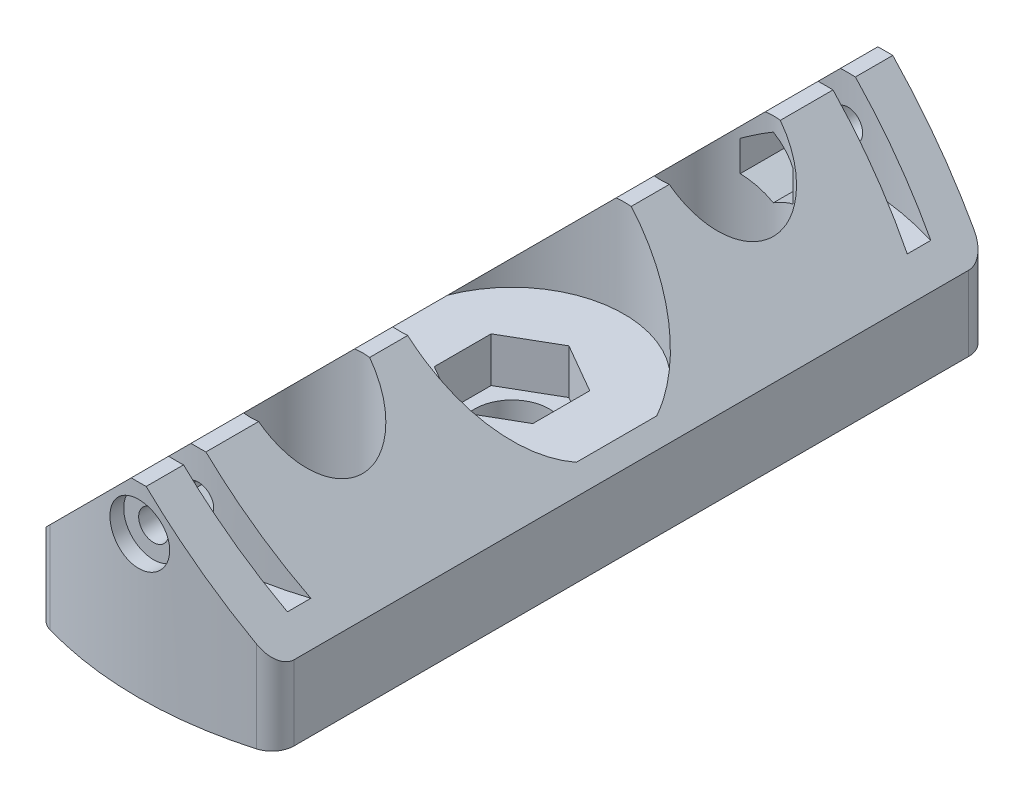
from build123d import *

# Parameters (mm, degrees)
SKETCH1_R               = 5
SKETCH1_R_2             = 6
BOSS_EXTRUDE1_DEPTH     = 25
SKETCH2_R               = 7.5
CUT_EXTRUDE1_DEPTH      = 24
SKETCH3_R               = 15
CUT_EXTRUDE2_DEPTH      = 13
CUT_EXTRUDE3_DEPTH      = 6
SKETCH5_R               = 45
SKETCH5_R_2             = 42
CUT_EXTRUDE_THIN1_DEPTH = 12
CHAMFER1_SIZE           = 15
SKETCH6_R               = 4
CUT_EXTRUDE4_DEPTH      = 2
SKETCH7_R               = 2
CUT_EXTRUDE5_DEPTH      = 20
CUT_EXTRUDE6_REACH      = 111.896
CUT_EXTRUDE6_END_RADIUS = 7.5
CUT_EXTRUDE6_START      = -7.5


with BuildPart() as part:
    # Sketch1 → Boss-Extrude1 (new body)
    with BuildSketch(Plane(origin=(0, 0, 0), x_dir=(1, 0, 0), z_dir=(0, 1, 0))):
        with BuildLine():
            Line((-16, 45.166359163), (-16, -45.166359163))
            ThreePointArc((-16, -45.166359163), (-15.396806386, -46.970609464), (-13.829787234, -48.049318258))
            ThreePointArc((-13.829787234, -48.049318258), (0, -50), (13.829787234, -48.049318258))
            ThreePointArc((13.829787234, -48.049318258), (15.396806386, -46.970609464), (16, -45.166359163))
            Line((16, -45.166359163), (16, 45.166359163))
            ThreePointArc((16, 45.166359163), (15.396806386, 46.970609464), (13.829787234, 48.049318258))
            ThreePointArc((13.829787234, 48.049318258), (0, 50), (-13.829787234, 48.049318258))
            ThreePointArc((-13.829787234, 48.049318258), (-15.396806386, 46.970609464), (-16, 45.166359163))
        make_face()
        with Locations(Location((0, 0, 0), (0, 0, 270))):
            Circle(SKETCH1_R, mode=Mode.SUBTRACT)
        with Locations(Location((0, -27.5, 0), (0, 0, 270))):
            Circle(SKETCH1_R_2, mode=Mode.SUBTRACT)
        with Locations(Location((0, 27.5, 0), (0, 0, 270))):
            Circle(SKETCH1_R_2, mode=Mode.SUBTRACT)
    extrude(amount=BOSS_EXTRUDE1_DEPTH)

    # Sketch2 → Cut-Extrude1 (cut)
    with BuildSketch(Plane(origin=(0, 25, 0), x_dir=(1, 0, 0), z_dir=(0, 1, 0))):
        with Locations(Location((0, 27.5, 0), (0, 0, 270))):
            Circle(SKETCH2_R)
        with Locations(Location((0, -27.5, 0), (0, 0, 270))):
            Circle(SKETCH2_R)
    extrude(amount=-CUT_EXTRUDE1_DEPTH, mode=Mode.SUBTRACT)

    # Sketch3 → Cut-Extrude2 (cut)
    with BuildSketch(Plane(origin=(0, 25, 0), x_dir=(1, 0, 0), z_dir=(0, 1, 0))):
        with Locations(Location((0, 0, 0), (0, 0, 270))):
            Circle(SKETCH3_R)
    extrude(amount=-CUT_EXTRUDE2_DEPTH, mode=Mode.SUBTRACT)

    # Sketch4 → Cut-Extrude3 (cut)
    with BuildSketch(Plane(origin=(0, 12, 0), x_dir=(1, 0, 0), z_dir=(0, 1, 0))):
        Polygon((0, 7.621023553), (-6.6, 3.810511777), (-6.6, -3.810511777), (0, -7.621023553), (6.6, -3.810511777), (6.6, 3.810511777), align=None)
    extrude(amount=-CUT_EXTRUDE3_DEPTH, mode=Mode.SUBTRACT)

    # Sketch5 → Cut-Extrude-Thin1 (cut)
    with BuildSketch(Plane(origin=(0, 25, 0), x_dir=(1, 0, 0), z_dir=(0, 1, 0))):
        Circle(SKETCH5_R)
        Circle(SKETCH5_R_2, mode=Mode.SUBTRACT)
    extrude(amount=-CUT_EXTRUDE_THIN1_DEPTH, mode=Mode.SUBTRACT)

    # Chamfer1
    # the kernel refuses this chamfer: 15 mm, written as the material it takes off along each edge
    with BuildSketch(Plane(origin=(-16, 25, -77.408220497), x_dir=(-0.02749587661058632, -0.9996219169112968, 0), z_dir=(0, 0, 1))) as chamfer1_piece_1:
        Polygon((CHAMFER1_SIZE * 0.999621916911, CHAMFER1_SIZE * 0.0274958766106), (-CHAMFER1_SIZE * 0.0274958766106, CHAMFER1_SIZE * 0.999621916911), (0, 0), align=None)
    extrude(amount=154.816440995, mode=Mode.SUBTRACT)
    with BuildSketch(Plane(origin=(16, 25, 77.408220497), x_dir=(-0.9996219169112968, 0.02749587661058632, 0), z_dir=(0, 0, -1))) as chamfer1_piece_2:
        Polygon((CHAMFER1_SIZE * 0.999621916911, -CHAMFER1_SIZE * 0.0274958766106), (-CHAMFER1_SIZE * 0.0274958766106, -CHAMFER1_SIZE * 0.999621916911), (0, 0), align=None)
    extrude(amount=154.816440995, mode=Mode.SUBTRACT)

    # Sketch6 → Cut-Extrude4 (cut)
    with BuildSketch(Plane.XY.offset(50)):
        with Locations((0, 19)):
            Circle(SKETCH6_R)
    cut_extrude4 = extrude(amount=-CUT_EXTRUDE4_DEPTH, mode=Mode.SUBTRACT)

    # Sketch7 → Cut-Extrude5 (cut)
    with BuildSketch(Plane.XY.offset(48)):
        with Locations((0, 19)):
            Circle(SKETCH7_R)
    cut_extrude5 = extrude(amount=-CUT_EXTRUDE5_DEPTH, mode=Mode.SUBTRACT)

    # Cut-Extrude6: up to this cylinder (the profile starts outside it)
    cut_extrude6_end = Plane(origin=(0, 19, 27.5), z_dir=(0, 1, 0)) * Cylinder(CUT_EXTRUDE6_END_RADIUS, 239.792, mode=Mode.PRIVATE)
    # Sketch8 → Cut-Extrude6 (cut, up to the surface)
    with BuildSketch(Plane.XY.offset(48).offset(CUT_EXTRUDE6_START), mode=Mode.PRIVATE) as cut_extrude6_sk1:
        Polygon((0, 14.900813089), (3.55, 16.950406544), (3.55, 21.049593456), (0, 23.099186911), (-3.55, 21.049593456), (-3.55, 16.950406544), align=None)
    cut_extrude6_tool1 = extrude(cut_extrude6_sk1.sketch, amount=-CUT_EXTRUDE6_REACH, mode=Mode.PRIVATE) - cut_extrude6_end
    cut_extrude6 = cut_extrude6_tool1.solids().sort_by_distance((0, 19, 40.5))[0]
    add(cut_extrude6, mode=Mode.SUBTRACT)

    # Mirror1: Cut-Extrude4, Cut-Extrude5, Cut-Extrude6 across plane
    add(cut_extrude4.mirror(Plane.XY), mode=Mode.SUBTRACT)
    add(cut_extrude5.mirror(Plane.XY), mode=Mode.SUBTRACT)
    add(cut_extrude6.mirror(Plane.XY), mode=Mode.SUBTRACT)


solid = part.part
